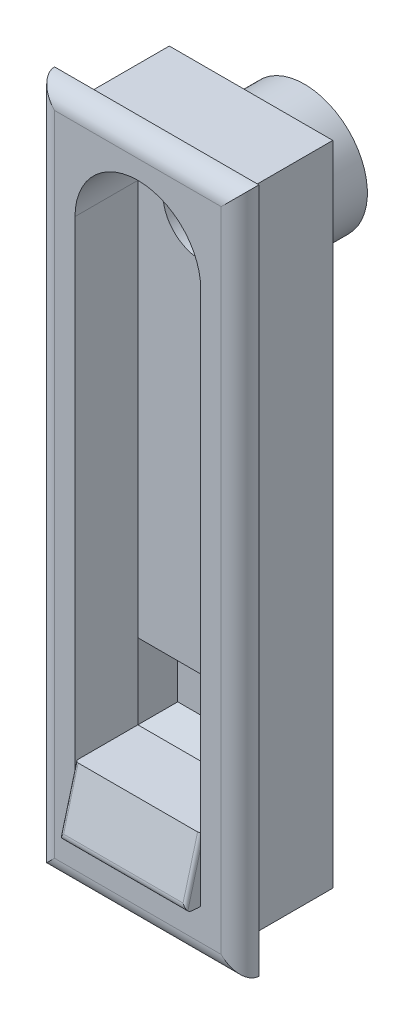
from build123d import *

# Parameters (mm, degrees)
SKETCH_1_W          = 32.5
SKETCH_1_H          = 109
EXTRUDE_1_DEPTH     = 3
FILLET_2_R          = 3
SKETCH_2_W          = 26
SKETCH_2_H          = 103
EXTRUDE_2_DEPTH     = 15
SKETCH_4_R          = 10
EXTRUDE_3_DEPTH     = 8.5
CUT_EXTRUDE_1_DEPTH = 10
SKETCH_6_W          = 20
SKETCH_6_H          = 12
CUT_EXTRUDE_2_DEPTH = 5
CUT_EXTRUDE_2_DRAFT = -15
SKETCH_7_W          = 20
SKETCH_7_H          = 10
REVOLVE_1_ANGLE     = 15
FILLET_START        = -47
FILLET_3_DEPTH      = 12
FILLET_START_2      = -11
FILLET_3_2_DEPTH    = 22
SKETCH_8_R          = 6
CUT_EXTRUDE_3_DEPTH = 64.76973092


with BuildPart() as part:
    # 草圖1 → 伸長1 (new body)
    with BuildSketch(Plane.XY):
        Rectangle(SKETCH_1_W, SKETCH_1_H)
    extrude(amount=EXTRUDE_1_DEPTH)

    # 圓角2
    fillet_2_edges = [part.edges().sort_by_distance(p)[0] for p in [
        (-16.25, 0, 3),
        (16.25, 0, 3),
        (0, -54.5, 3),
        (0, 54.5, 3),
    ]]
    fillet(fillet_2_edges, radius=FILLET_2_R - 0.0001)  # a hair under: the kernel refuses the full size

    # 草圖2 → 伸長2 (add)
    with BuildSketch(Plane(origin=(0, 0, 0), x_dir=(-1, 0, 0), z_dir=(0, 0, -1))):
        Rectangle(SKETCH_2_W, SKETCH_2_H)
    extrude(amount=EXTRUDE_2_DEPTH)

    # 草圖4 → 伸長3 (add)
    with BuildSketch(Plane(origin=(0, 0, -15), x_dir=(-1, 0, 0), z_dir=(0, 0, -1))):
        with Locations((0, 38.5)):
            Circle(SKETCH_4_R)
    extrude(amount=EXTRUDE_3_DEPTH)

    # 草圖5 → 除料-伸長1 (cut)
    with BuildSketch(Plane.XY.offset(3)):
        with BuildLine():
            Line((-10, 38.5), (-10, -36.5))
            Line((-10, -36.5), (10, -36.5))
            Line((10, -36.5), (10, 38.5))
            ThreePointArc((10, 38.5), (0, 48.5), (-10, 38.5))
        make_face()
    extrude(amount=-CUT_EXTRUDE_1_DEPTH, mode=Mode.SUBTRACT)


with BuildPart() as cut_extrude_2_tool:
    # 草圖6 → 除料-伸長2 (with draft: the straight prism first)
    with BuildSketch(Plane.XY.offset(-7)):
        with Locations((0, -30.5)):
            Rectangle(SKETCH_6_W, SKETCH_6_H)
    extrude(amount=-CUT_EXTRUDE_2_DEPTH)
    # 除料-伸長2: the draft: its side faces are tilted about the plane it starts from
    cut_extrude_2_sides = [cut_extrude_2_tool.faces().sort_by_distance(p)[0] for p in [
        (0, -36.5, -9.5),
        (10, -30.5, -9.5),
        (0, -24.5, -9.5),
        (-10, -30.5, -9.5),
    ]]
    draft(cut_extrude_2_sides, Plane.XY.offset(-7), CUT_EXTRUDE_2_DRAFT)


with BuildPart() as part_1:
    add(part.part)

    # 除料-伸長2: cut by cut_extrude_2_tool
    add(cut_extrude_2_tool.part, mode=Mode.SUBTRACT)

    # 草圖7 → 旋轉1 (revolve)
    with BuildSketch(Plane.XY.offset(3)):
        with Locations((0, -41.5)):
            Rectangle(SKETCH_7_W, SKETCH_7_H)
    revolve(axis=Axis((-10, -36.5, 3), (-1, 0, 0)), revolution_arc=REVOLVE_1_ANGLE)

    # 圓角3: read off the stored shape, not the designer's step
    # 圓角3 outline → 圓角3 (cut)
    with BuildSketch(Plane(origin=(0, 0, 0), x_dir=(1, 0, 0), z_dir=(0, 0.9659258262890682, -0.2588190451025211)).offset(FILLET_START)):
        with BuildLine():
            ThreePointArc((10, 7.049117667), (9.853553391, 6.695564276), (9.5, 6.549117667))
            Line((9.5, 6.549117667), (10, 6.549117667))
            Line((10, 6.549117667), (10, 7.049117667))
        make_face()
        with BuildLine():
            ThreePointArc((-9.5, 6.549117667), (-9.853553391, 6.695564276), (-10, 7.049117667))
            Line((-10, 7.049117667), (-10, 6.549117667))
            Line((-10, 6.549117667), (-9.5, 6.549117667))
        make_face()
    extrude(amount=FILLET_3_DEPTH, mode=Mode.SUBTRACT)

    # Fillet 3 2 outline → Fillet 3 2 (cut)
    with BuildSketch(Plane.YZ.offset(FILLET_START_2)):
        with BuildLine():
            ThreePointArc((-46.387024756, 4.498913432), (-45.945734853, 5.185884966), (-45.139503235, 5.314947915))
            Line((-45.139503235, 5.314947915), (-46.159258263, 5.588190451))
            ThreePointArc((-46.159258263, 5.588190451), (-46.288305577, 5.04672273), (-46.387024756, 4.498913432))
        make_face()
    extrude(amount=FILLET_3_2_DEPTH, mode=Mode.SUBTRACT)

    # 草圖8 → 除料-伸長3 (cut, through all)
    with BuildSketch(Plane(origin=(0, 0, -23.5), x_dir=(-1, 0, 0), z_dir=(0, 0, -1))):
        with Locations((0, 38.5)):
            Circle(SKETCH_8_R)
    extrude(amount=-CUT_EXTRUDE_3_DEPTH, mode=Mode.SUBTRACT)


solid = part_1.part
